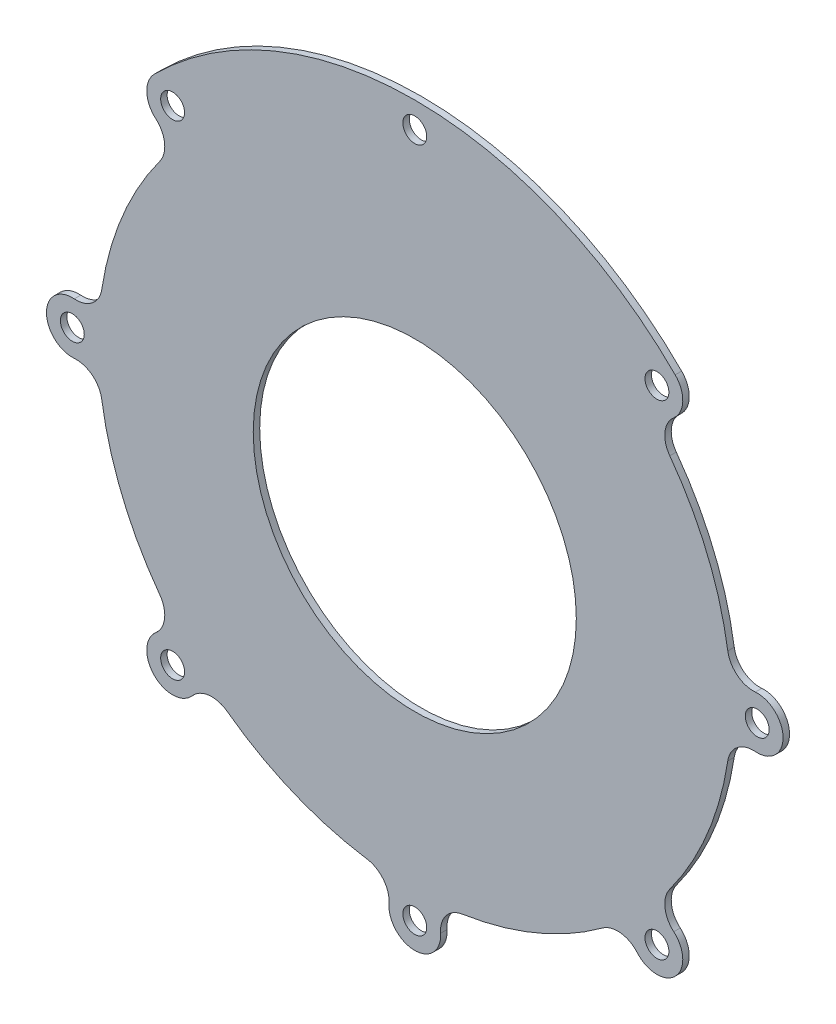
from build123d import *

# Parameters (mm, degrees)
NPTH_R              = 1.85
NPTH_R_2            = 25
BOSS_EXTRUDE1_DEPTH = 1


with BuildPart() as part:
    # NPTH → Boss-Extrude1 (new body)
    with BuildSketch(Plane.XY):
        with BuildLine():
            ThreePointArc((-40.083553498, 34.442832912), (-38.716100837, 31.861298217), (-39.46852702, 29.03851537))
            ThreePointArc((-39.46852702, 29.03851537), (-45.270097093, 18.751488186), (-48.441794233, 7.375131965))
            ThreePointArc((-48.441794233, 7.375131965), (-49.90575747, 4.847077417), (-52.698113208, 3.988591777))
            ThreePointArc((-52.698113208, 3.988591777), (-57, 0), (-52.698113208, -3.988591777))
            ThreePointArc((-52.698113208, -3.988591777), (-49.90575747, -4.847077417), (-48.441794233, -7.375131965))
            ThreePointArc((-48.441794233, -7.375131965), (-45.270097093, -18.751488186), (-39.46852702, -29.03851537))
            ThreePointArc((-39.46852702, -29.03851537), (-38.716100837, -31.861298217), (-40.083553498, -34.442832912))
            ThreePointArc((-40.083553498, -34.442832912), (-40.305086528, -40.305086528), (-34.442832912, -40.083553498))
            ThreePointArc((-34.442832912, -40.083553498), (-31.861298217, -38.716100837), (-29.03851537, -39.46852702))
            ThreePointArc((-29.03851537, -39.46852702), (-18.751488186, -45.270097093), (-7.375131965, -48.441794233))
            ThreePointArc((-7.375131965, -48.441794233), (-4.847077417, -49.90575747), (-3.988591777, -52.698113208))
            ThreePointArc((-3.988591777, -52.698113208), (0, -57), (3.988591777, -52.698113208))
            ThreePointArc((3.988591777, -52.698113208), (4.847077417, -49.90575747), (7.375131965, -48.441794233))
            ThreePointArc((7.375131965, -48.441794233), (18.751488186, -45.270097093), (29.03851537, -39.46852702))
            ThreePointArc((29.03851537, -39.46852702), (31.861298217, -38.716100837), (34.442832912, -40.083553498))
            ThreePointArc((34.442832912, -40.083553498), (40.305086528, -40.305086528), (40.083553498, -34.442832912))
            ThreePointArc((40.083553498, -34.442832912), (38.716100837, -31.861298217), (39.46852702, -29.03851537))
            ThreePointArc((39.46852702, -29.03851537), (45.270097093, -18.751488186), (48.441794233, -7.375131965))
            ThreePointArc((48.441794233, -7.375131965), (49.90575747, -4.847077417), (52.698113208, -3.988591777))
            ThreePointArc((52.698113208, -3.988591777), (57, 0), (52.698113208, 3.988591777))
            ThreePointArc((52.698113208, 3.988591777), (49.90575747, 4.847077417), (48.441794233, 7.375131965))
            ThreePointArc((48.441794233, 7.375131965), (45.270097093, 18.751488186), (39.46852702, 29.03851537))
            ThreePointArc((39.46852702, 29.03851537), (38.716100837, 31.861298217), (40.083553498, 34.442832912))
            ThreePointArc((40.083553498, 34.442832912), (41.47380633, 37.325608267), (40.305086528, 40.305086528))
            ThreePointArc((40.305086528, 40.305086528), (37.148240852, 43.232027498), (33.779497471, 45.912368166))
            ThreePointArc((33.779497471, 45.912368166), (-4.301886792, 56.837432824), (-40.305086528, 40.305086528))
            ThreePointArc((-40.305086528, 40.305086528), (-41.47380633, 37.325608267), (-40.083553498, 34.442832912))
        make_face()
        with Locations((-37.476659403, -37.476659403)):
            Circle(NPTH_R, mode=Mode.SUBTRACT)
        with Locations((-53, 0)):
            Circle(NPTH_R, mode=Mode.SUBTRACT)
        with Locations((0, -53)):
            Circle(NPTH_R, mode=Mode.SUBTRACT)
        with Locations((37.476659403, -37.476659403)):
            Circle(NPTH_R, mode=Mode.SUBTRACT)
        Circle(NPTH_R_2, mode=Mode.SUBTRACT)
        with Locations((53, 0)):
            Circle(NPTH_R, mode=Mode.SUBTRACT)
        with Locations((-37.476659403, 37.476659403)):
            Circle(NPTH_R, mode=Mode.SUBTRACT)
        with Locations((37.476659403, 37.476659403)):
            Circle(NPTH_R, mode=Mode.SUBTRACT)
        with Locations((0, 53)):
            Circle(NPTH_R, mode=Mode.SUBTRACT)
    extrude(amount=BOSS_EXTRUDE1_DEPTH)


solid = part.part
